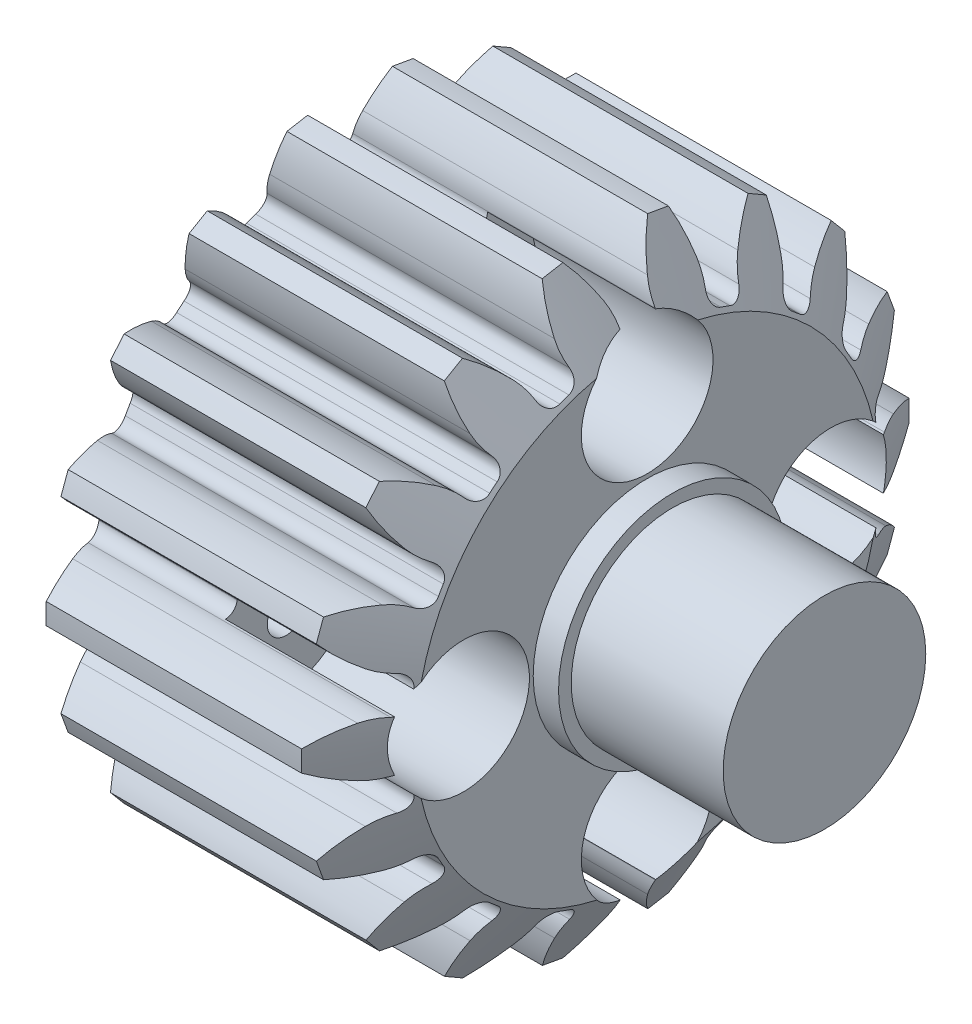
from build123d import *

# Parameters (mm, degrees)
SKETCH1_R           = 0.75
BOSS_EXTRUDE2_DEPTH = 12.5
SKETCH2_R           = 2.6
CUT_EXTRUDE1_DEPTH  = 7
SKETCH5_R           = 4
BOSS_EXTRUDE3_DEPTH = 7
SKETCH6_R           = 4.5
BOSS_EXTRUDE4_DEPTH = 1


with BuildPart() as part:
    # Sketch1 → Boss-Extrude2 (new body)
    with BuildSketch(Plane(origin=(0, 0, 0), x_dir=(0, 0, -1), z_dir=(1, 0, 0))):
        with BuildLine():
            ThreePointArc((-182.894225912, 46.705572024), (-182.997445272, 47.46275457), (-183.208254985, 48.197287693))
            ThreePointArc((-183.208254985, 48.197287693), (-183.616220678, 48.276530545), (-184.02668568, 48.341599106))
            ThreePointArc((-184.02668568, 48.341599106), (-184.476007136, 47.723464919), (-184.83197329, 47.047249169))
            ThreePointArc((-184.83197329, 47.047249169), (-184.958724471, 46.649849638), (-185.000846187, 46.23485806))
            ThreePointArc((-185.000846187, 46.23485806), (-185.151133341, 45.885754391), (-185.508692183, 45.756869654))
            ThreePointArc((-185.508692183, 45.756869654), (-185.604340436, 45.758345532), (-185.69999881, 45.758837509))
            ThreePointArc((-185.69999881, 45.758837509), (-185.795657184, 45.758345532), (-185.891305437, 45.756869654))
            ThreePointArc((-185.891305437, 45.756869654), (-186.248864278, 45.885754391), (-186.399151433, 46.23485806))
            ThreePointArc((-186.399151433, 46.23485806), (-186.441273149, 46.649849638), (-186.56802433, 47.047249169))
            ThreePointArc((-186.56802433, 47.047249169), (-186.923990483, 47.723464919), (-187.373311939, 48.341599106))
            ThreePointArc((-187.373311939, 48.341599106), (-187.783776942, 48.276530545), (-188.191742634, 48.197287693))
            ThreePointArc((-188.191742634, 48.197287693), (-188.402552348, 47.46275457), (-188.505771707, 46.705572024))
            ThreePointArc((-188.505771707, 46.705572024), (-188.488960212, 46.288787161), (-188.386606199, 45.884416162))
            ThreePointArc((-188.386606199, 45.884416162), (-188.408429442, 45.504964786), (-188.700343671, 45.261560424))
            ThreePointArc((-188.700343671, 45.261560424), (-188.790728409, 45.230233666), (-188.880786143, 45.197978882))
            ThreePointArc((-188.880786143, 45.197978882), (-188.970507345, 45.164799485), (-189.059882522, 45.130698984))
            ThreePointArc((-189.059882522, 45.130698984), (-189.439959103, 45.129518694), (-189.70058332, 45.406167601))
            ThreePointArc((-189.70058332, 45.406167601), (-189.882100265, 45.781725649), (-190.137126059, 46.111807599))
            ThreePointArc((-190.137126059, 46.111807599), (-190.702904234, 46.625494955), (-191.336542634, 47.0526741))
            ThreePointArc((-191.336542634, 47.0526741), (-191.69999881, 46.851142355), (-192.056258509, 46.637145946))
            ThreePointArc((-192.056258509, 46.637145946), (-192.003129717, 45.874809422), (-191.841152505, 45.127987471))
            ThreePointArc((-191.841152505, 45.127987471), (-191.682806048, 44.742087681), (-191.44832171, 44.397110372))
            ThreePointArc((-191.44832171, 44.397110372), (-191.339048837, 44.033078725), (-191.530109289, 43.704512895))
            ThreePointArc((-191.530109289, 43.704512895), (-191.604328778, 43.644161972), (-191.67792358, 43.58305083))
            ThreePointArc((-191.67792358, 43.58305083), (-191.750885909, 43.521185937), (-191.823208046, 43.458573837))
            ThreePointArc((-191.823208046, 43.458573837), (-192.179959521, 43.32747088), (-192.519485674, 43.498297085))
            ThreePointArc((-192.519485674, 43.498297085), (-192.818504225, 43.78912376), (-193.171044757, 44.012075373))
            ThreePointArc((-193.171044757, 44.012075373), (-193.878393757, 44.301276058), (-194.619922958, 44.485976053))
            ThreePointArc((-194.619922958, 44.485976053), (-194.892532127, 44.172288825), (-195.154115655, 43.849349986))
            ThreePointArc((-195.154115655, 43.849349986), (-194.843456474, 43.151159097), (-194.435819532, 42.50477549))
            ThreePointArc((-194.435819532, 42.50477549), (-194.155037034, 42.196305982), (-193.816704643, 41.952331717))
            ThreePointArc((-193.816704643, 41.952331717), (-193.589515574, 41.647627389), (-193.656677539, 41.273529981))
            ThreePointArc((-193.656677539, 41.273529981), (-193.705779814, 41.191434103), (-193.754035065, 41.108837509))
            ThreePointArc((-193.754035065, 41.108837509), (-193.801438188, 41.025748939), (-193.847984166, 40.942177183))
            ThreePointArc((-193.847984166, 40.942177183), (-194.138381043, 40.696964511), (-194.515857266, 40.741363852))
            ThreePointArc((-194.515857266, 40.741363852), (-194.896311373, 40.912381165), (-195.303845052, 41.001311187))
            ThreePointArc((-195.303845052, 41.001311187), (-196.067448148, 41.031143331), (-196.827428785, 40.951086629))
            ThreePointArc((-196.827428785, 40.951086629), (-196.976310259, 40.563079229), (-197.111666782, 40.170149149))
            ThreePointArc((-197.111666782, 40.170149149), (-196.580947294, 39.620316021), (-195.976817654, 39.15233416))
            ThreePointArc((-195.976817654, 39.15233416), (-195.607465627, 38.95850091), (-195.206093063, 38.844956586))
            ThreePointArc((-195.206093063, 38.844956586), (-194.888390154, 38.636331416), (-194.823552907, 38.261824096))
            ThreePointArc((-194.823552907, 38.261824096), (-194.841615508, 38.167885239), (-194.858710913, 38.073765561))
            ThreePointArc((-194.858710913, 38.073765561), (-194.874837313, 37.979475022), (-194.889993001, 37.885023598))
            ThreePointArc((-194.889993001, 37.885023598), (-195.07900913, 37.555277478), (-195.448906221, 37.467894739))
            ThreePointArc((-195.448906221, 37.467894739), (-195.864907504, 37.498475478), (-196.278279754, 37.442657636))
            ThreePointArc((-196.278279754, 37.442657636), (-197.006035142, 37.209523041), (-197.692802333, 36.874365663))
            ThreePointArc((-197.692802333, 36.874365663), (-197.69999881, 36.458837509), (-197.692802333, 36.043309355))
            ThreePointArc((-197.692802333, 36.043309355), (-197.006035142, 35.708151977), (-196.278279754, 35.475017382))
            ThreePointArc((-196.278279754, 35.475017382), (-195.864907504, 35.419199541), (-195.448906221, 35.449780279))
            ThreePointArc((-195.448906221, 35.449780279), (-195.07900913, 35.36239754), (-194.889993001, 35.032651421))
            ThreePointArc((-194.889993001, 35.032651421), (-194.874837313, 34.938199996), (-194.858710913, 34.843909457))
            ThreePointArc((-194.858710913, 34.843909457), (-194.841615508, 34.74978978), (-194.823552907, 34.655850922))
            ThreePointArc((-194.823552907, 34.655850922), (-194.888390154, 34.281343603), (-195.206093063, 34.072718432))
            ThreePointArc((-195.206093063, 34.072718432), (-195.607465627, 33.959174108), (-195.976817654, 33.765340858))
            ThreePointArc((-195.976817654, 33.765340858), (-196.580947294, 33.297358998), (-197.111666782, 32.747525869))
            ThreePointArc((-197.111666782, 32.747525869), (-196.976310259, 32.354595789), (-196.827428785, 31.966588389))
            ThreePointArc((-196.827428785, 31.966588389), (-196.067448148, 31.886531687), (-195.303845052, 31.916363831))
            ThreePointArc((-195.303845052, 31.916363831), (-194.896311373, 32.005293853), (-194.515857266, 32.176311166))
            ThreePointArc((-194.515857266, 32.176311166), (-194.138381043, 32.220710507), (-193.847984166, 31.975497835))
            ThreePointArc((-193.847984166, 31.975497835), (-193.801438188, 31.891926079), (-193.754035065, 31.808837509))
            ThreePointArc((-193.754035065, 31.808837509), (-193.705779814, 31.726240916), (-193.656677539, 31.644145038))
            ThreePointArc((-193.656677539, 31.644145038), (-193.589515574, 31.270047629), (-193.816704643, 30.965343301))
            ThreePointArc((-193.816704643, 30.965343301), (-194.155037034, 30.721369036), (-194.435819532, 30.412899528))
            ThreePointArc((-194.435819532, 30.412899528), (-194.843456474, 29.766515921), (-195.154115655, 29.068325032))
            ThreePointArc((-195.154115655, 29.068325032), (-194.892532127, 28.745386193), (-194.619922958, 28.431698966))
            ThreePointArc((-194.619922958, 28.431698966), (-193.878393757, 28.61639896), (-193.171044757, 28.905599645))
            ThreePointArc((-193.171044757, 28.905599645), (-192.818504225, 29.128551259), (-192.519485674, 29.419377933))
            ThreePointArc((-192.519485674, 29.419377933), (-192.179959521, 29.590204139), (-191.823208046, 29.459101182))
            ThreePointArc((-191.823208046, 29.459101182), (-191.750885909, 29.396489082), (-191.67792358, 29.334624188))
            ThreePointArc((-191.67792358, 29.334624188), (-191.604328778, 29.273513047), (-191.530109289, 29.213162123))
            ThreePointArc((-191.530109289, 29.213162123), (-191.339048837, 28.884596293), (-191.44832171, 28.520564647))
            ThreePointArc((-191.44832171, 28.520564647), (-191.682806048, 28.175587337), (-191.841152505, 27.789687547))
            ThreePointArc((-191.841152505, 27.789687547), (-192.003129717, 27.042865596), (-192.056258509, 26.280529072))
            ThreePointArc((-192.056258509, 26.280529072), (-191.69999881, 26.066532664), (-191.336542634, 25.865000918))
            ThreePointArc((-191.336542634, 25.865000918), (-190.702904234, 26.292180064), (-190.137126059, 26.80586742))
            ThreePointArc((-190.137126059, 26.80586742), (-189.882100265, 27.135949369), (-189.70058332, 27.511507417))
            ThreePointArc((-189.70058332, 27.511507417), (-189.439959103, 27.788156325), (-189.059882522, 27.786976034))
            ThreePointArc((-189.059882522, 27.786976034), (-188.970507345, 27.752875533), (-188.880786143, 27.719696136))
            ThreePointArc((-188.880786143, 27.719696136), (-188.790728409, 27.687441352), (-188.700343671, 27.656114594))
            ThreePointArc((-188.700343671, 27.656114594), (-188.408429442, 27.412710232), (-188.386606199, 27.033258856))
            ThreePointArc((-188.386606199, 27.033258856), (-188.488960212, 26.628887858), (-188.505771707, 26.212102994))
            ThreePointArc((-188.505771707, 26.212102994), (-188.402552348, 25.454920448), (-188.191742634, 24.720387326))
            ThreePointArc((-188.191742634, 24.720387326), (-187.783776942, 24.641144473), (-187.373311939, 24.576075912))
            ThreePointArc((-187.373311939, 24.576075912), (-186.923990483, 25.194210099), (-186.56802433, 25.87042585))
            ThreePointArc((-186.56802433, 25.87042585), (-186.441273149, 26.26782538), (-186.399151433, 26.682816958))
            ThreePointArc((-186.399151433, 26.682816958), (-186.248864278, 27.031920627), (-185.891305437, 27.160805364))
            ThreePointArc((-185.891305437, 27.160805364), (-185.795657184, 27.159329486), (-185.69999881, 27.158837509))
            ThreePointArc((-185.69999881, 27.158837509), (-185.604340436, 27.159329486), (-185.508692183, 27.160805364))
            ThreePointArc((-185.508692183, 27.160805364), (-185.151133341, 27.031920627), (-185.000846187, 26.682816958))
            ThreePointArc((-185.000846187, 26.682816958), (-184.958724471, 26.26782538), (-184.83197329, 25.87042585))
            ThreePointArc((-184.83197329, 25.87042585), (-184.476007136, 25.194210099), (-184.02668568, 24.576075912))
            ThreePointArc((-184.02668568, 24.576075912), (-183.616220678, 24.641144473), (-183.208254985, 24.720387326))
            ThreePointArc((-183.208254985, 24.720387326), (-182.997445272, 25.454920448), (-182.894225912, 26.212102994))
            ThreePointArc((-182.894225912, 26.212102994), (-182.911037407, 26.628887858), (-183.01339142, 27.033258856))
            ThreePointArc((-183.01339142, 27.033258856), (-182.991568177, 27.412710232), (-182.699653948, 27.656114594))
            ThreePointArc((-182.699653948, 27.656114594), (-182.609269211, 27.687441352), (-182.519211477, 27.719696136))
            ThreePointArc((-182.519211477, 27.719696136), (-182.429490275, 27.752875533), (-182.340115097, 27.786976034))
            ThreePointArc((-182.340115097, 27.786976034), (-181.960038516, 27.788156325), (-181.699414299, 27.511507417))
            ThreePointArc((-181.699414299, 27.511507417), (-181.517897354, 27.135949369), (-181.262871561, 26.80586742))
            ThreePointArc((-181.262871561, 26.80586742), (-180.697093385, 26.292180064), (-180.063454985, 25.865000918))
            ThreePointArc((-180.063454985, 25.865000918), (-179.69999881, 26.066532664), (-179.343739111, 26.280529072))
            ThreePointArc((-179.343739111, 26.280529072), (-179.396867903, 27.042865596), (-179.558845115, 27.789687547))
            ThreePointArc((-179.558845115, 27.789687547), (-179.717191571, 28.175587337), (-179.951675909, 28.520564647))
            ThreePointArc((-179.951675909, 28.520564647), (-180.060948783, 28.884596293), (-179.869888331, 29.213162123))
            ThreePointArc((-179.869888331, 29.213162123), (-179.795668842, 29.273513047), (-179.72207404, 29.334624188))
            ThreePointArc((-179.72207404, 29.334624188), (-179.64911171, 29.396489082), (-179.576789574, 29.459101182))
            ThreePointArc((-179.576789574, 29.459101182), (-179.220038098, 29.590204139), (-178.880511946, 29.419377933))
            ThreePointArc((-178.880511946, 29.419377933), (-178.581493395, 29.128551259), (-178.228952863, 28.905599645))
            ThreePointArc((-178.228952863, 28.905599645), (-177.521603863, 28.61639896), (-176.780074662, 28.431698966))
            ThreePointArc((-176.780074662, 28.431698966), (-176.507465492, 28.745386193), (-176.245881964, 29.068325032))
            ThreePointArc((-176.245881964, 29.068325032), (-176.556541145, 29.766515921), (-176.964178087, 30.412899528))
            ThreePointArc((-176.964178087, 30.412899528), (-177.244960585, 30.721369036), (-177.583292976, 30.965343301))
            ThreePointArc((-177.583292976, 30.965343301), (-177.810482045, 31.270047629), (-177.74332008, 31.644145038))
            ThreePointArc((-177.74332008, 31.644145038), (-177.694217806, 31.726240916), (-177.645962555, 31.808837509))
            ThreePointArc((-177.645962555, 31.808837509), (-177.598559432, 31.891926079), (-177.552013453, 31.975497835))
            ThreePointArc((-177.552013453, 31.975497835), (-177.261616576, 32.220710507), (-176.884140353, 32.176311166))
            ThreePointArc((-176.884140353, 32.176311166), (-176.503686246, 32.005293853), (-176.096152567, 31.916363831))
            ThreePointArc((-176.096152567, 31.916363831), (-175.332549472, 31.886531687), (-174.572568835, 31.966588389))
            ThreePointArc((-174.572568835, 31.966588389), (-174.42368736, 32.354595789), (-174.288330837, 32.747525869))
            ThreePointArc((-174.288330837, 32.747525869), (-174.819050325, 33.297358998), (-175.423179965, 33.765340858))
            ThreePointArc((-175.423179965, 33.765340858), (-175.792531992, 33.959174108), (-176.193904556, 34.072718432))
            ThreePointArc((-176.193904556, 34.072718432), (-176.511607466, 34.281343603), (-176.576444712, 34.655850922))
            ThreePointArc((-176.576444712, 34.655850922), (-176.558382111, 34.74978978), (-176.541286707, 34.843909457))
            ThreePointArc((-176.541286707, 34.843909457), (-176.525160307, 34.938199996), (-176.510004618, 35.032651421))
            ThreePointArc((-176.510004618, 35.032651421), (-176.320988489, 35.36239754), (-175.951091398, 35.449780279))
            ThreePointArc((-175.951091398, 35.449780279), (-175.535090116, 35.419199541), (-175.121717866, 35.475017382))
            ThreePointArc((-175.121717866, 35.475017382), (-174.393962478, 35.708151977), (-173.707195286, 36.043309355))
            ThreePointArc((-173.707195286, 36.043309355), (-173.69999881, 36.458837509), (-173.707195286, 36.874365663))
            ThreePointArc((-173.707195286, 36.874365663), (-174.393962478, 37.209523041), (-175.121717866, 37.442657636))
            ThreePointArc((-175.121717866, 37.442657636), (-175.535090116, 37.498475478), (-175.951091398, 37.467894739))
            ThreePointArc((-175.951091398, 37.467894739), (-176.320988489, 37.555277478), (-176.510004618, 37.885023598))
            ThreePointArc((-176.510004618, 37.885023598), (-176.525160307, 37.979475022), (-176.541286707, 38.073765561))
            ThreePointArc((-176.541286707, 38.073765561), (-176.558382111, 38.167885239), (-176.576444712, 38.261824096))
            ThreePointArc((-176.576444712, 38.261824096), (-176.511607466, 38.636331416), (-176.193904556, 38.844956586))
            ThreePointArc((-176.193904556, 38.844956586), (-175.792531992, 38.95850091), (-175.423179965, 39.15233416))
            ThreePointArc((-175.423179965, 39.15233416), (-174.819050325, 39.620316021), (-174.288330837, 40.170149149))
            ThreePointArc((-174.288330837, 40.170149149), (-174.42368736, 40.563079229), (-174.572568835, 40.951086629))
            ThreePointArc((-174.572568835, 40.951086629), (-175.332549472, 41.031143331), (-176.096152567, 41.001311187))
            ThreePointArc((-176.096152567, 41.001311187), (-176.503686246, 40.912381165), (-176.884140353, 40.741363852))
            ThreePointArc((-176.884140353, 40.741363852), (-177.261616576, 40.696964511), (-177.552013453, 40.942177183))
            ThreePointArc((-177.552013453, 40.942177183), (-177.598559432, 41.025748939), (-177.645962555, 41.108837509))
            ThreePointArc((-177.645962555, 41.108837509), (-177.694217806, 41.191434103), (-177.74332008, 41.273529981))
            ThreePointArc((-177.74332008, 41.273529981), (-177.810482045, 41.647627389), (-177.583292976, 41.952331717))
            ThreePointArc((-177.583292976, 41.952331717), (-177.244960585, 42.196305982), (-176.964178087, 42.50477549))
            ThreePointArc((-176.964178087, 42.50477549), (-176.556541145, 43.151159097), (-176.245881964, 43.849349986))
            ThreePointArc((-176.245881964, 43.849349986), (-176.507465492, 44.172288825), (-176.780074662, 44.485976053))
            ThreePointArc((-176.780074662, 44.485976053), (-177.521603863, 44.301276058), (-178.228952863, 44.012075373))
            ThreePointArc((-178.228952863, 44.012075373), (-178.581493395, 43.78912376), (-178.880511946, 43.498297085))
            ThreePointArc((-178.880511946, 43.498297085), (-179.220038098, 43.32747088), (-179.576789574, 43.458573837))
            ThreePointArc((-179.576789574, 43.458573837), (-179.64911171, 43.521185937), (-179.72207404, 43.58305083))
            ThreePointArc((-179.72207404, 43.58305083), (-179.795668842, 43.644161972), (-179.869888331, 43.704512895))
            ThreePointArc((-179.869888331, 43.704512895), (-180.060948783, 44.033078725), (-179.951675909, 44.397110372))
            ThreePointArc((-179.951675909, 44.397110372), (-179.717191571, 44.742087681), (-179.558845115, 45.127987471))
            ThreePointArc((-179.558845115, 45.127987471), (-179.396867903, 45.874809422), (-179.343739111, 46.637145946))
            ThreePointArc((-179.343739111, 46.637145946), (-179.69999881, 46.851142355), (-180.063454985, 47.0526741))
            ThreePointArc((-180.063454985, 47.0526741), (-180.697093385, 46.625494955), (-181.262871561, 46.111807599))
            ThreePointArc((-181.262871561, 46.111807599), (-181.517897354, 45.781725649), (-181.699414299, 45.406167601))
            ThreePointArc((-181.699414299, 45.406167601), (-181.960038516, 45.129518694), (-182.340115097, 45.130698984))
            ThreePointArc((-182.340115097, 45.130698984), (-182.429490275, 45.164799485), (-182.519211477, 45.197978882))
            ThreePointArc((-182.519211477, 45.197978882), (-182.609269211, 45.230233666), (-182.699653948, 45.261560424))
            ThreePointArc((-182.699653948, 45.261560424), (-182.991568177, 45.504964786), (-183.01339142, 45.884416162))
            ThreePointArc((-183.01339142, 45.884416162), (-182.911037407, 46.288787161), (-182.894225912, 46.705572024))
        make_face()
        with Locations((-185.69999881, 29.208837509)):
            Circle(SKETCH1_R, mode=Mode.SUBTRACT)
        with Locations((-192.94999881, 36.458837509)):
            Circle(SKETCH1_R, mode=Mode.SUBTRACT)
        with Locations((-185.69999881, 43.708837509)):
            Circle(SKETCH1_R, mode=Mode.SUBTRACT)
        with Locations((-178.44999881, 36.458837509)):
            Circle(SKETCH1_R, mode=Mode.SUBTRACT)
    extrude(amount=BOSS_EXTRUDE2_DEPTH)

    # Sketch2 → Cut-Extrude1 (cut)
    with BuildSketch(Plane(origin=(12.5, 0, 0), x_dir=(0, 0, -1), z_dir=(1, 0, 0))):
        with Locations((-185.69999881, 43.708837509)):
            Circle(SKETCH2_R)
        with Locations((-178.44999881, 36.458837509)):
            Circle(SKETCH2_R)
        with Locations((-185.69999881, 29.208837509)):
            Circle(SKETCH2_R)
        with Locations((-192.94999881, 36.458837509)):
            Circle(SKETCH2_R)
    extrude(amount=-CUT_EXTRUDE1_DEPTH, mode=Mode.SUBTRACT)

    # Sketch3 → Cut-Revolve1 (revolve, cut)
    with BuildSketch(Plane(origin=(0, 36.45, 0), x_dir=(1, 0, 0), z_dir=(0, 1, 0))):
        Polygon((12.5, -176.558566494), (15.964101615, -170.558566494), (9.035898385, -170.558566494), align=None)
        Polygon((0, -170.558566494), (0, -176.558566494), (1.607695155, -170.558566494), align=None)
    revolve(axis=Axis((-4.688006743, 36.45, 185.69999881), (1, 0, 0)), mode=Mode.SUBTRACT)

    # Sketch5 → Boss-Extrude3 (add)
    with BuildSketch(Plane(origin=(12.5, 0, 0), x_dir=(0, 0, -1), z_dir=(1, 0, 0))):
        with Locations((-185.69999881, 36.45)):
            Circle(SKETCH5_R)
    extrude(amount=BOSS_EXTRUDE3_DEPTH)

    # Sketch6 → Boss-Extrude4 (add)
    with BuildSketch(Plane(origin=(12.5, 0, 0), x_dir=(0, 0, -1), z_dir=(1, 0, 0))):
        with Locations((-185.69999881, 36.45)):
            Circle(SKETCH6_R)
    extrude(amount=BOSS_EXTRUDE4_DEPTH)


solid = part.part
